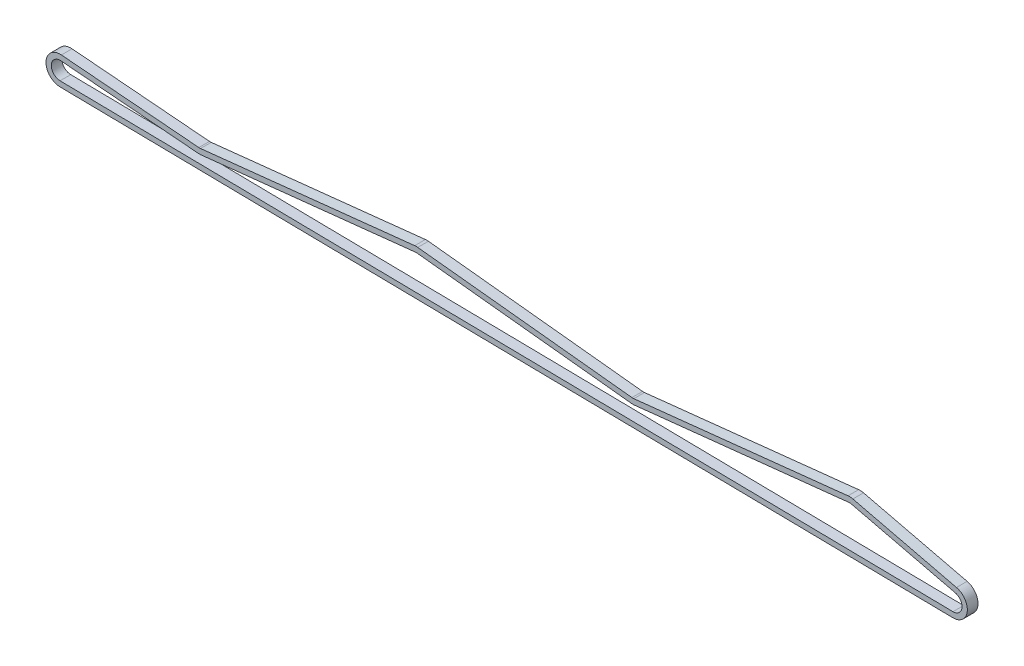
from build123d import *

# Parameters (mm, degrees)
BOSS_EXTRUDE1_DEPTH = 3


with BuildPart() as part:
    # Sketch1 → Boss-Extrude1 (new, symmetric)
    with BuildSketch(Plane.XY):
        with BuildLine():
            Line((307.252596216, -12.999110299), (-195.591212367, -5.499110299))
            ThreePointArc((-195.591212367, -5.499110299), (-203.46228284, 2.892238007), (-194.807193354, 10.472337133))
            Line((-194.807193354, 10.472337133), (-117.387348628, 4.017289292))
            ThreePointArc((-117.387348628, 4.017289292), (-116.912967419, 4.000347368), (-116.439117406, 4.028467225))
            Line((-116.439117406, 4.028467225), (4.175636692, 16.95445244))
            ThreePointArc((4.175636692, 16.95445244), (5.028095708, 17), (5.880554725, 16.95445244))
            Line((5.880554725, 16.95445244), (126.495308823, 4.028467225))
            ThreePointArc((126.495308823, 4.028467225), (127.028095708, 4), (127.560882594, 4.028467225))
            Line((127.560882594, 4.028467225), (248.175636692, 16.95445244))
            ThreePointArc((248.175636692, 16.95445244), (249.542716812, 16.983430661), (250.894762375, 16.779174478))
            Line((250.894762375, 16.779174478), (309.238570958, 2.779174478))
            ThreePointArc((309.238570958, 2.779174478), (315.309276851, -5.999057987), (307.252596216, -12.999110299))
        make_face()
        with BuildLine():
            Line((-195.056459955, 7.482710708), (-117.63661523, 1.027662867))
            ThreePointArc((-117.63661523, 1.027662867), (-116.877605295, 1.000555788), (-116.119445275, 1.04554756))
            Line((-116.119445275, 1.04554756), (4.495308823, 13.971532775))
            ThreePointArc((4.495308823, 13.971532775), (5.028095708, 14), (5.560882594, 13.971532775))
            Line((5.560882594, 13.971532775), (126.175636692, 1.04554756))
            ThreePointArc((126.175636692, 1.04554756), (127.028095708, 1), (127.880554725, 1.04554756))
            Line((127.880554725, 1.04554756), (248.495308823, 13.971532775))
            ThreePointArc((248.495308823, 13.971532775), (249.349733898, 13.989644163), (250.194762375, 13.861984049))
            Line((250.194762375, 13.861984049), (308.538570958, -0.138015951))
            ThreePointArc((308.538570958, -0.138015951), (312.332762141, -5.624411242), (307.297336744, -9.999443937))
            Line((307.297336744, -9.999443937), (-195.546471839, -2.499443937))
            ThreePointArc((-195.546471839, -2.499443937), (-200.465890884, 2.745148754), (-195.056459955, 7.482710708))
        make_face(mode=Mode.SUBTRACT)
    extrude(amount=BOSS_EXTRUDE1_DEPTH, both=True)


solid = part.part
